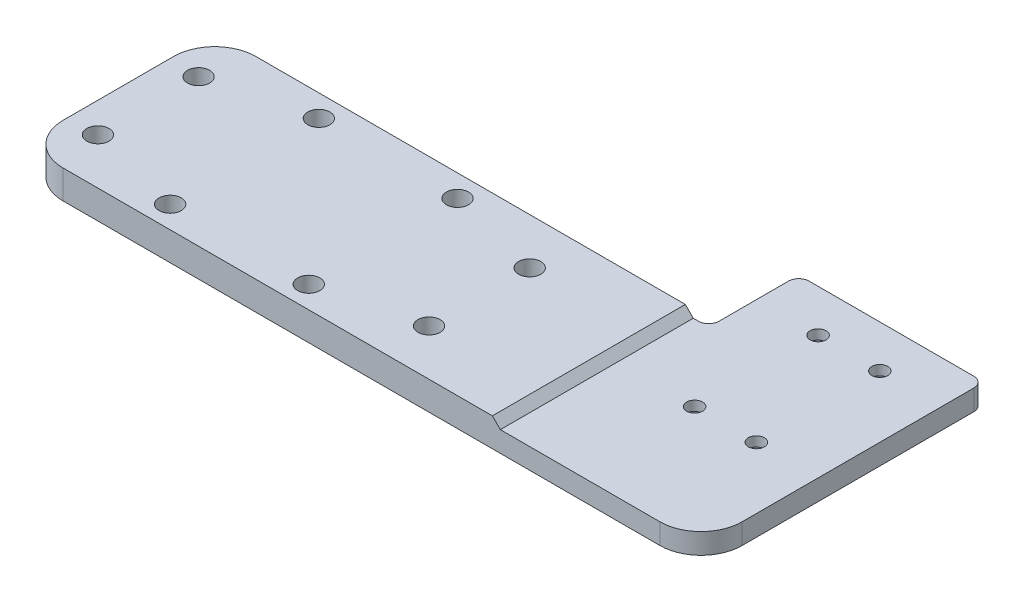
from build123d import *

# Parameters (mm, degrees)
BOSS_EXTRUDE1_DEPTH                                = 5.55
SKETCH2_W                                          = 39
SKETCH2_H                                          = 55
CUT_EXTRUDE1_DEPTH                                 = 1.55
FILLET1_R                                          = 8
CBORE_FOR_M2_5_PAN_HEAD_MACHINE_SCREW1_D           = 3.1
CBORE_FOR_M2_5_PAN_HEAD_MACHINE_SCREW1_CBORE_D     = 6
CBORE_FOR_M2_5_PAN_HEAD_MACHINE_SCREW1_CBORE_DEPTH = 2.1
FILLET2_R                                          = 2
CHAMFER1_SIZE                                      = 1.55
F_6_CLEARANCE_HOLE1_D                              = 4.3053


with BuildPart() as part:
    # Sketch1 → Boss-Extrude1 (new body)
    with BuildSketch(Plane(origin=(0, 0, 0), x_dir=(1, 0, 0), z_dir=(0, 1, 0))):
        Polygon((-38, -18.75), (94, -18.75), (94, 36.25), (58, 36.25), (58, 18.75), (-38, 18.75), align=None)
    extrude(amount=BOSS_EXTRUDE1_DEPTH)

    # Sketch2 → Cut-Extrude1 (cut)
    with BuildSketch(Plane(origin=(0, 5.55, 0), x_dir=(1, 0, 0), z_dir=(0, 1, 0))):
        with Locations((74.5, 8.75)):
            Rectangle(SKETCH2_W, SKETCH2_H)
    extrude(amount=-CUT_EXTRUDE1_DEPTH, mode=Mode.SUBTRACT)

    # Fillet1
    fillet1_edges = [part.edges().sort_by_distance(p)[0] for p in [
        (-38, 2.775, 18.75),
        (-38, 2.775, -18.75),
        (94, 2, 18.75),
    ]]
    fillet(fillet1_edges, radius=FILLET1_R)

    # CBORE for M2.5 Pan Head Machine Screw1 (through all)
    with Locations(Plane(origin=(0, 0, 0), x_dir=(-1, 0, 0), z_dir=(0, -1, 0))):
        with Locations((-82, 28), (-82, 4), (-70, 4), (-70, 28)):
            CounterBoreHole(CBORE_FOR_M2_5_PAN_HEAD_MACHINE_SCREW1_D / 2, CBORE_FOR_M2_5_PAN_HEAD_MACHINE_SCREW1_CBORE_D / 2, CBORE_FOR_M2_5_PAN_HEAD_MACHINE_SCREW1_CBORE_DEPTH)

    # Fillet2
    fillet2_edges = [part.edges().sort_by_distance(p)[0] for p in [
        (94, 2, -36.25),
        (58, 2, -18.75),
        (58, 2, -36.25),
    ]]
    fillet(fillet2_edges, radius=FILLET2_R)

    # Chamfer1
    chamfer1_edges = [part.edges().sort_by_distance(p)[0] for p in [
        (55, 5.55, 0),
    ]]
    chamfer(chamfer1_edges, length=CHAMFER1_SIZE - 0.0001)  # a hair under: the kernel refuses the full size

    # #6 Clearance Hole1 (through all)
    with Locations(Plane(origin=(0, 0, 0), x_dir=(-1, 0, 0), z_dir=(0, -1, 0))):
        with Locations((-32.175187039, 9.779), (-32.175187039, -9.779), (32.175187039, 9.779), (32.175187039, -9.779), (13.470384182, -14.45), (-13.470384182, -14.45), (13.470384182, 14.45), (-13.470384182, 14.45)):
            Hole(F_6_CLEARANCE_HOLE1_D / 2)


solid = part.part
